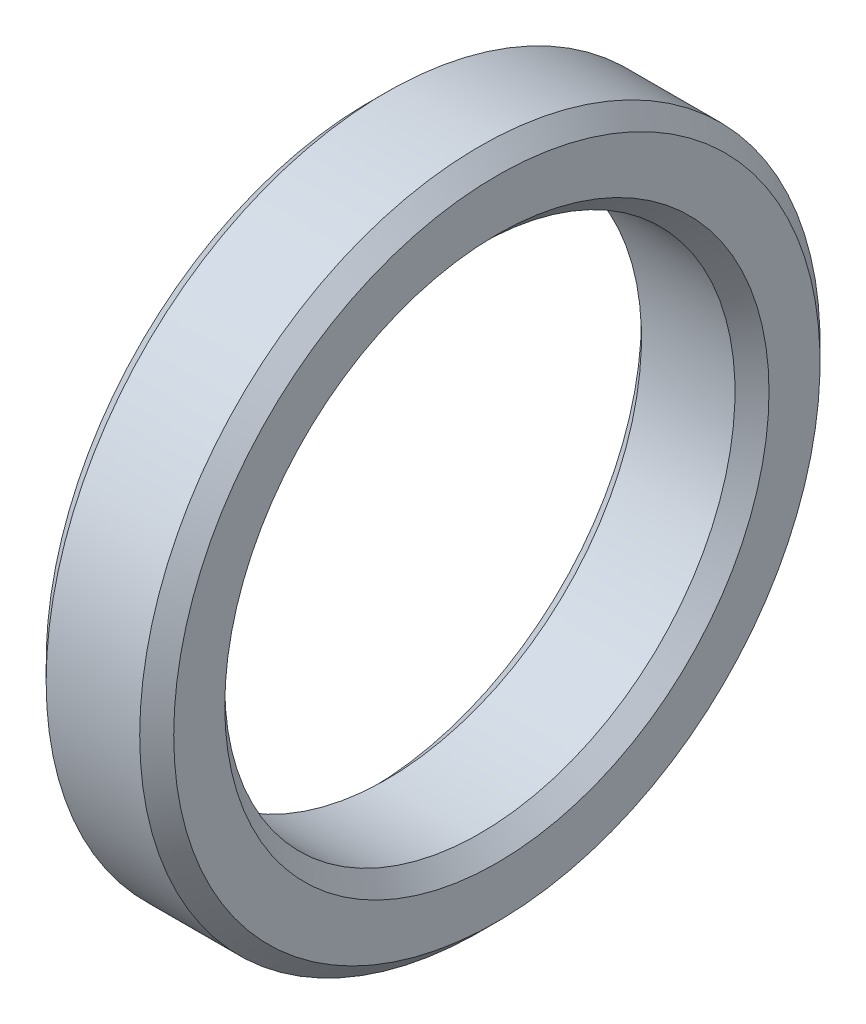
from build123d import *

# Parameters (mm, degrees)
SKETCH1_W     = 1.5
SKETCH1_H     = 1
CHAMFER1_SIZE = 0.2


with BuildPart() as part:
    # Sketch1 → Revolve1 (revolve)
    with BuildSketch(Plane.XY):
        with Locations((0.75, 3.5)):
            Rectangle(SKETCH1_W, SKETCH1_H)
    revolve(axis=Axis((0, 0, 0), (1, 0, 0)))

    # Chamfer1
    chamfer1_edges = [part.edges().sort_by_distance(p)[0] for p in [
        (0, -4, 0),
        (1.5, -4, 0),
        (1.5, -3, 0),
        (0, -3, 0),
    ]]
    chamfer(chamfer1_edges, length=CHAMFER1_SIZE)


solid = part.part
